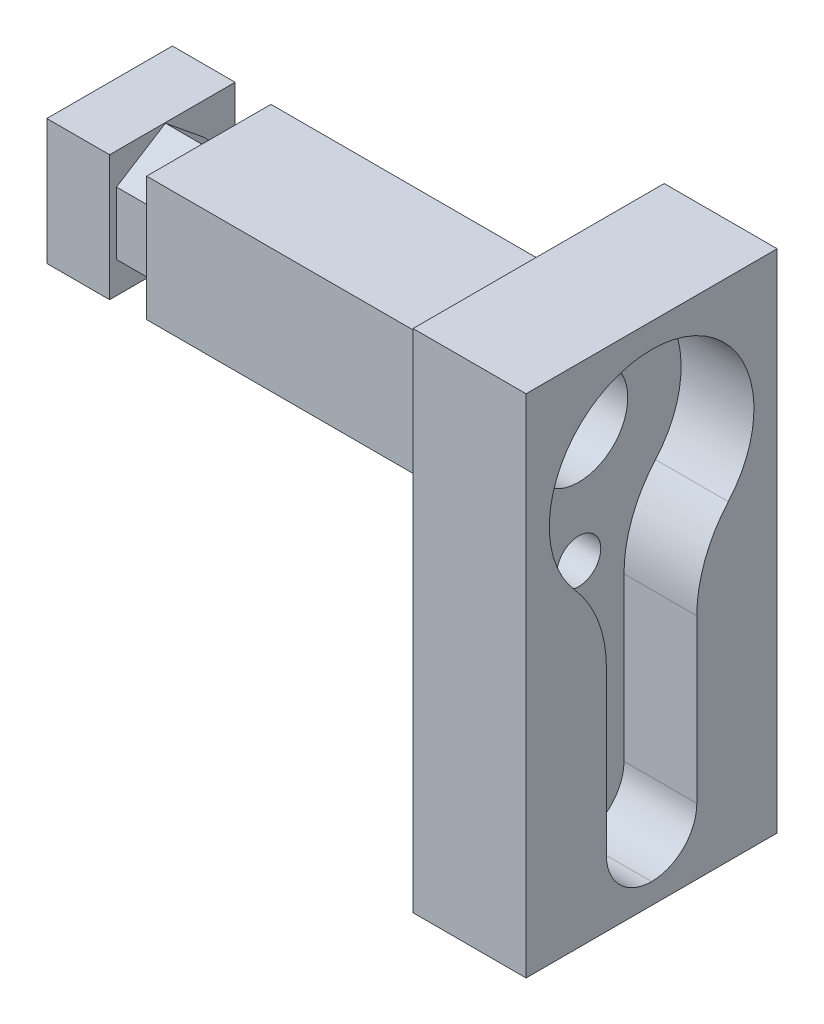
from build123d import *

# Parameters (mm, degrees)
SKETCH1_W            = 20
SKETCH1_H            = 20
BOSS_EXTRUDE1_DEPTH  = 20
SKETCH2_W            = 45
SKETCH2_H            = 70
BOSS_EXTRUDE2_DEPTH  = 12
CUT_EXTRUDE1_DEPTH   = 5.8
FILLET1_R            = 3.6
FILLET2_R            = 10
SKETCH5_R            = 3.9
CUT_EXTRUDE2_DEPTH   = 53.490475326
CUT_EXTRUDE3_REACH   = 51.17
SKETCH6_R            = 1.75
SKETCH7_W            = 12
SKETCH7_H            = 45
CUT_EXTRUDE4_DEPTH   = 4.8
SKETCH9_W            = 12
SKETCH9_H            = 45
CUT_EXTRUDE5_DEPTH   = 23.8
SKETCH10_W           = 12.5
SKETCH10_H           = 41.4
CUT_EXTRUDE6_DEPTH   = 23.8
SKETCH11_W           = 20
SKETCH11_H           = 1.2
CUT_EXTRUDE7_DEPTH   = 23.8
BOSS_EXTRUDE3_START  = 20
SKETCH12_W           = 20
SKETCH12_H           = 20
SKETCH12_R           = 3.9
BOSS_EXTRUDE3_DEPTH  = 20
SKETCH13_W           = 20.2
SKETCH13_H           = 20.2
SKETCH13_R           = 3.9
BOSS_EXTRUDE4_DEPTH  = 40
SKETCH14_W           = 12
SKETCH14_H           = 20
BOSS_EXTRUDE5_DEPTH  = 0.1
SKETCH17_R           = 4.83091966
BOSS_EXTRUDE8_DEPTH  = 39
SKETCH18_W           = 25.638800628
SKETCH18_H           = 46.621959296
CUT_EXTRUDE8_DEPTH   = 43
SKETCH19_W           = 9.9
SKETCH19_H           = 9.9
BOSS_EXTRUDE9_DEPTH  = 26.27
BOSS_EXTRUDE10_DEPTH = 2.9
SKETCH21_W           = 10
SKETCH21_H           = 10
BOSS_EXTRUDE11_DEPTH = 5


with BuildPart() as part:
    # Sketch1 → Boss-Extrude1 (new body)
    with BuildSketch(Plane(origin=(0, 0, 0), x_dir=(0, 0, -1), z_dir=(1, 0, 0))):
        Rectangle(SKETCH1_W, SKETCH1_H)
    extrude(amount=BOSS_EXTRUDE1_DEPTH)

    # Sketch2 → Boss-Extrude2 (add)
    with BuildSketch(Plane(origin=(20, 0, 0), x_dir=(0, 0, -1), z_dir=(1, 0, 0))):
        Rectangle(SKETCH2_W, SKETCH2_H)
    extrude(amount=BOSS_EXTRUDE2_DEPTH)

    # Sketch4 → Cut-Extrude1 (cut)
    with BuildSketch(Plane(origin=(32, 0, 0), x_dir=(0, 0, -1), z_dir=(1, 0, 0))):
        with BuildLine():
            Line((3.6, -28.55), (-3.6, -28.55))
            Line((-3.6, -28.55), (-3.6, -7.311805523))
            ThreePointArc((-3.6, -7.311805523), (0, 8.15), (3.6, -7.311805523))
            Line((3.6, -7.311805523), (3.6, -28.55))
        make_face()
    extrude(amount=-CUT_EXTRUDE1_DEPTH, mode=Mode.SUBTRACT)

    # Fillet1
    fillet1_edges = [part.edges().sort_by_distance(p)[0] for p in [
        (29.1, -28.55, 3.6),
        (29.1, -28.55, -3.6),
    ]]
    fillet(fillet1_edges, radius=FILLET1_R - 0.0001)  # a hair under: the kernel refuses the full size

    # Fillet2
    fillet2_edges = [part.edges().sort_by_distance(p)[0] for p in [
        (29.1, -7.311805523, 3.6),
        (29.1, -7.311805523, -3.6),
    ]]
    fillet(fillet2_edges, radius=FILLET2_R)

    # Sketch5 → Cut-Extrude2 (cut, through all)
    with BuildSketch(Plane.ZY):
        Circle(SKETCH5_R)
    extrude(amount=-CUT_EXTRUDE2_DEPTH, mode=Mode.SUBTRACT)

    # Sketch6 → Cut-Extrude3 (cut, up to next)
    with BuildSketch(Plane(origin=(26.2, 0, 0), x_dir=(0, 0, -1), z_dir=(1, 0, 0)), mode=Mode.PRIVATE) as cut_extrude3_sk1:
        with Locations((0, -20.6)):
            Circle(SKETCH6_R)
    cut_extrude3_tool1 = extrude(cut_extrude3_sk1.sketch, amount=-CUT_EXTRUDE3_REACH, mode=Mode.PRIVATE) & part.part
    # Sketch6 → Cut-Extrude3 (cut, up to next)
    with BuildSketch(Plane(origin=(26.2, 0, 0), x_dir=(0, 0, -1), z_dir=(1, 0, 0)), mode=Mode.PRIVATE) as cut_extrude3_sk2:
        with Locations((0, -9.35)):
            Circle(SKETCH6_R)
    cut_extrude3_tool2 = extrude(cut_extrude3_sk2.sketch, amount=-CUT_EXTRUDE3_REACH, mode=Mode.PRIVATE) & part.part
    add(cut_extrude3_tool1.solids().sort_by_distance((26.2, -20.6, 0))[0], mode=Mode.SUBTRACT)
    add(cut_extrude3_tool2.solids().sort_by_distance((26.2, -9.35, 0))[0], mode=Mode.SUBTRACT)

    # Sketch7 → Cut-Extrude4 (cut)
    with BuildSketch(Plane.XZ.offset(35)):
        with Locations((26, 0)):
            Rectangle(SKETCH7_W, SKETCH7_H)
    extrude(amount=-CUT_EXTRUDE4_DEPTH, mode=Mode.SUBTRACT)

    # Sketch9 → Cut-Extrude5 (cut)
    with BuildSketch(Plane(origin=(0, 35, 0), x_dir=(1, 0, 0), z_dir=(0, 1, 0))):
        with Locations((26, 0)):
            Rectangle(SKETCH9_W, SKETCH9_H)
    extrude(amount=-CUT_EXTRUDE5_DEPTH, mode=Mode.SUBTRACT)

    # Sketch10 → Cut-Extrude6 (cut)
    with BuildSketch(Plane.ZY.offset(-20)):
        with Locations((-16.25, -9.5)):
            Rectangle(SKETCH10_W, SKETCH10_H)
        with Locations((16.25, -9.5)):
            Rectangle(SKETCH10_W, SKETCH10_H)
    extrude(amount=-CUT_EXTRUDE6_DEPTH, mode=Mode.SUBTRACT)

    # Sketch11 → Cut-Extrude7 (cut)
    with BuildSketch(Plane.ZY.offset(-20)):
        with Locations((0, 10.6)):
            Rectangle(SKETCH11_W, SKETCH11_H)
    extrude(amount=-CUT_EXTRUDE7_DEPTH, mode=Mode.SUBTRACT)

    # Sketch12 → Boss-Extrude3 (add)
    with BuildSketch(Plane.ZY.offset(BOSS_EXTRUDE3_START)):
        Rectangle(SKETCH12_W, SKETCH12_H)
        Circle(SKETCH12_R, mode=Mode.SUBTRACT)
    extrude(amount=-BOSS_EXTRUDE3_DEPTH)

    # Sketch13 → Boss-Extrude4 (add)
    with BuildSketch(Plane.ZY.offset(20)):
        Rectangle(SKETCH13_W, SKETCH13_H)
        Circle(SKETCH13_R, mode=Mode.SUBTRACT)
    extrude(amount=-BOSS_EXTRUDE4_DEPTH)

    # Sketch14 → Boss-Extrude5 (add)
    with BuildSketch(Plane(origin=(0, 10, 0), x_dir=(1, 0, 0), z_dir=(0, 1, 0))):
        with Locations((26, 0)):
            Rectangle(SKETCH14_W, SKETCH14_H)
    extrude(amount=BOSS_EXTRUDE5_DEPTH)

    # Sketch17 → Boss-Extrude8 (add)
    with BuildSketch(Plane.ZY.offset(20)):
        Circle(SKETCH17_R)
    extrude(amount=-BOSS_EXTRUDE8_DEPTH)

    # Sketch18 → Cut-Extrude8 (cut)
    with BuildSketch(Plane.ZY.offset(20)):
        with Locations((-2.719400314, -13.210979648)):
            Rectangle(SKETCH18_W, SKETCH18_H)
    extrude(amount=-CUT_EXTRUDE8_DEPTH, mode=Mode.SUBTRACT)

    # Sketch19 → Boss-Extrude9 (add)
    with BuildSketch(Plane.ZY.offset(-23)):
        Rectangle(SKETCH19_W, SKETCH19_H)
    extrude(amount=BOSS_EXTRUDE9_DEPTH)

    # Sketch20 → Boss-Extrude10 (add)
    with BuildSketch(Plane.ZY.offset(3.27)):
        Polygon((0.55, 4.95), (-2.45, 2.5), (-2.45, -2.5), (0.55, -4.95), (4.45, -2.5), (4.45, 2.5), align=None)
    extrude(amount=BOSS_EXTRUDE10_DEPTH)

    # Sketch21 → Boss-Extrude11 (add)
    with BuildSketch(Plane.ZY.offset(6.17)):
        Rectangle(SKETCH21_W, SKETCH21_H)
    extrude(amount=BOSS_EXTRUDE11_DEPTH)


solid = part.part
